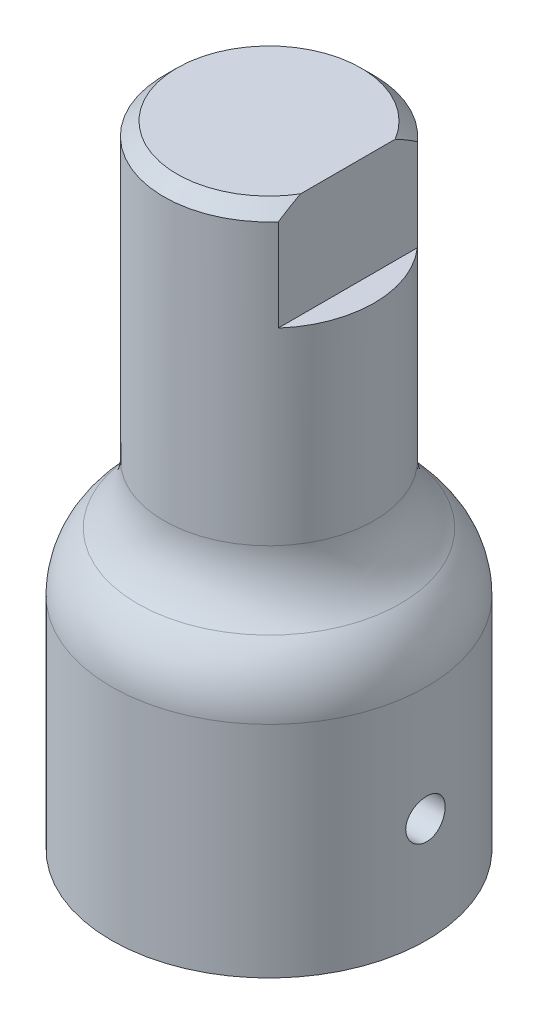
from build123d import *

# Parameters (mm, degrees)
SKETCH1_R           = 6.35
BASE_EXTRUDE_DEPTH  = 38.1
SKETCH3_R           = 9.525
BOSS_EXTRUDE1_DEPTH = 15.875
CUT_EXTRUDE1_DEPTH  = 12.7
FILLET1_R           = 4.7625
FILLET2_R           = 4.7625
SKETCH5_R           = 1.190625
CUT_EXTRUDE2_DEPTH  = 42.790769119
CUT_EXTRUDE3_START  = -6.35
CUT_EXTRUDE3_DEPTH  = 6.35
CHAMFER1_SIZE       = 0.79375


with BuildPart() as part:
    # Sketch1 → Base-Extrude (new body)
    with BuildSketch(Plane(origin=(0, 0, 0), x_dir=(-1, 0, 0), z_dir=(0, 1, 0))):
        with Locations(Location((0, 0, 0), (0, 0, 270))):
            Circle(SKETCH1_R)
    extrude(amount=BASE_EXTRUDE_DEPTH)

    # Sketch3 → Boss-Extrude1 (add)
    with BuildSketch(Plane(origin=(0, 0, 0), x_dir=(-1, 0, 0), z_dir=(0, 1, 0))):
        with Locations(Location((0, 0, 0), (0, 0, 90))):
            Circle(SKETCH3_R)
    extrude(amount=BOSS_EXTRUDE1_DEPTH)

    # Sketch4 → Cut-Extrude1 (cut)
    with BuildSketch(Plane(origin=(0, 0, 0), x_dir=(-1, 0, 0), z_dir=(0, 1, 0))):
        with BuildLine():
            Line((-4.7625, 4.200130206), (-4.7625, -4.200130206))
            ThreePointArc((-4.7625, -4.200130206), (6.35, 0), (-4.7625, 4.200130206))
        make_face()
    extrude(amount=CUT_EXTRUDE1_DEPTH, mode=Mode.SUBTRACT)

    # Fillet1
    # the kernel refuses this fillet: 4.7625 mm, written as the material it adds along each edge
    with BuildSketch(Plane(origin=(0, 15.875, 0), x_dir=(0, 0, -1), z_dir=(-1, 0, 0))) as fillet1_piece_1:
        with BuildLine():
            CenterArc((11.1125, -4.490128061), FILLET1_R, 109.471220634, 70.528779366)
            Line((6.35, -4.490128061), (6.25475, -4.490128061))
            Line((6.25475, -4.490128061), (6.25475, 0))
            Line((6.25475, 0), (6.35, 0.09525))
            ThreePointArc((6.35, 0.09525), (7.9375, 0.09525), (9.49325, 0.089802561))
            Line((9.49325, 0.089802561), (9.525, 0))
        make_face()
    revolve(axis=Axis((0, 15.875, 0), (0, -1, 0)))

    # Fillet2
    fillet2_edges = [part.edges().sort_by_distance(p)[0] for p in [
        (9.525, 15.875, 0),
    ]]
    fillet(fillet2_edges, radius=FILLET2_R)

    # Sketch5 → Cut-Extrude2 (cut, through all)
    with BuildSketch(Plane.ZY.offset(-4.7625)):
        with Locations((0, 6.35)):
            Circle(SKETCH5_R)
    extrude(amount=-CUT_EXTRUDE2_DEPTH, mode=Mode.SUBTRACT)

    # Sketch7 → Cut-Extrude3 (cut)
    with BuildSketch(Plane(origin=(0, 38.1, 0), x_dir=(-1, 0, 0), z_dir=(0, 1, 0)).offset(CUT_EXTRUDE3_START)):
        with BuildLine():
            Line((-4.7625, 4.200130206), (-4.7625, -4.200130206))
            ThreePointArc((-4.7625, -4.200130206), (-6.35, 0), (-4.7625, 4.200130206))
        make_face()
    extrude(amount=CUT_EXTRUDE3_DEPTH, mode=Mode.SUBTRACT)

    # Chamfer1
    chamfer1_edges = [part.edges().sort_by_distance(p)[0] for p in [
        (-5.787630206, 38.1, 2.612630206),
    ]]
    chamfer(chamfer1_edges, length=CHAMFER1_SIZE)


solid = part.part
